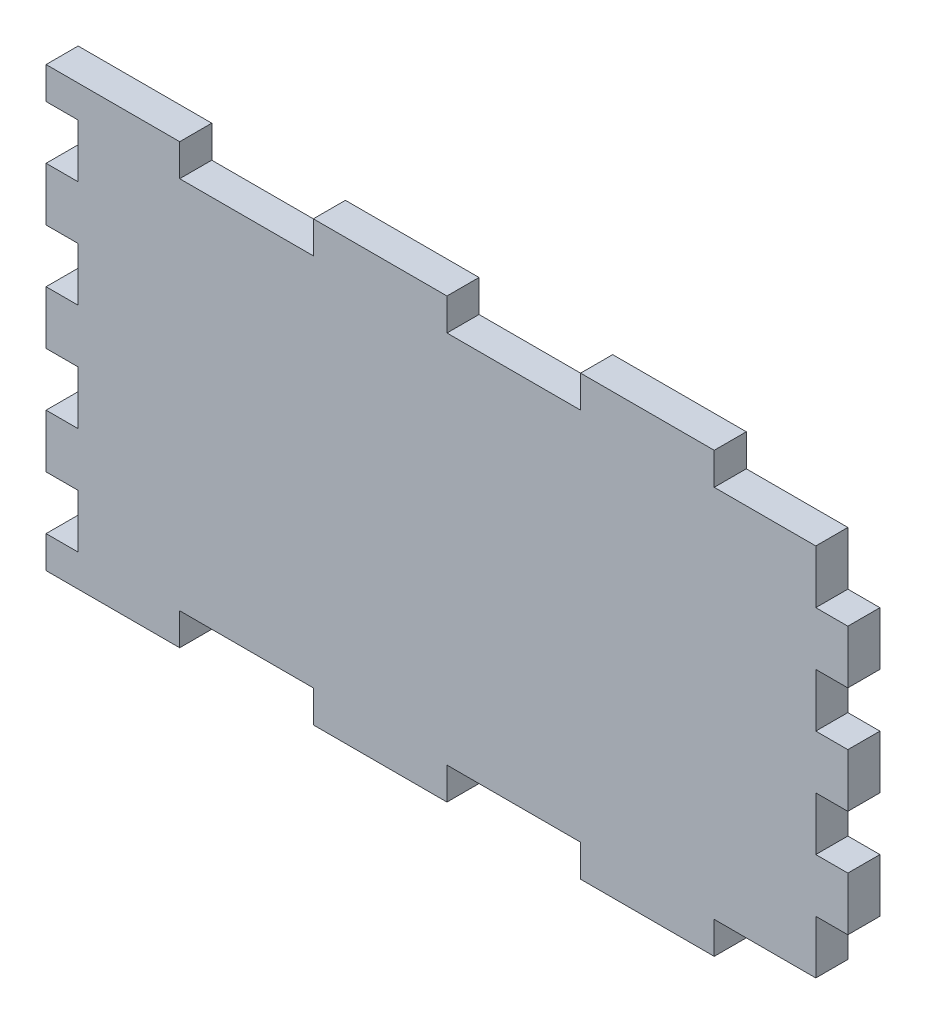
from build123d import *

# Parameters (mm, degrees)
SKETCH1_W           = 150
SKETCH1_H           = 82
BOSS_EXTRUDE1_DEPTH = 6
SKETCH3_W           = 6
SKETCH3_H           = 10
CUT_EXTRUDE1_DEPTH  = 10
SKETCH4_W           = 25
SKETCH4_H           = 6
CUT_EXTRUDE2_DEPTH  = 6


with BuildPart() as part:
    # Sketch1 → Boss-Extrude1 (new body)
    with BuildSketch(Plane.XY):
        Rectangle(SKETCH1_W, SKETCH1_H)
    extrude(amount=BOSS_EXTRUDE1_DEPTH)

    # Sketch3 → Cut-Extrude1 (cut)
    with BuildSketch(Plane.XY.offset(6)):
        with Locations((-72, 30)):
            Rectangle(SKETCH3_W, SKETCH3_H)
        with Locations((72, 30)):
            Rectangle(SKETCH3_W, SKETCH3_H)
        with Locations((72, 10)):
            Rectangle(SKETCH3_W, SKETCH3_H)
        with Locations((-72, 10)):
            Rectangle(SKETCH3_W, SKETCH3_H)
        with Locations((-72, -10)):
            Rectangle(SKETCH3_W, SKETCH3_H)
        with Locations((72, -10)):
            Rectangle(SKETCH3_W, SKETCH3_H)
        with Locations((-72, -30)):
            Rectangle(SKETCH3_W, SKETCH3_H)
        with Locations((72, -30)):
            Rectangle(SKETCH3_W, SKETCH3_H)
    extrude(amount=-CUT_EXTRUDE1_DEPTH, mode=Mode.SUBTRACT)

    # Sketch4 → Cut-Extrude2 (cut)
    with BuildSketch(Plane.XY.offset(6)):
        with Locations((12.5, -38)):
            Rectangle(SKETCH4_W, SKETCH4_H)
        with Locations((62.5, -38)):
            Rectangle(SKETCH4_W, SKETCH4_H)
        with Locations((-37.5, -38)):
            Rectangle(SKETCH4_W, SKETCH4_H)
    cut_extrude2 = extrude(amount=-CUT_EXTRUDE2_DEPTH, mode=Mode.SUBTRACT)

    # Mirror1: Cut-Extrude2 across plane
    add(cut_extrude2.mirror(Plane.ZX), mode=Mode.SUBTRACT)


solid = part.part
